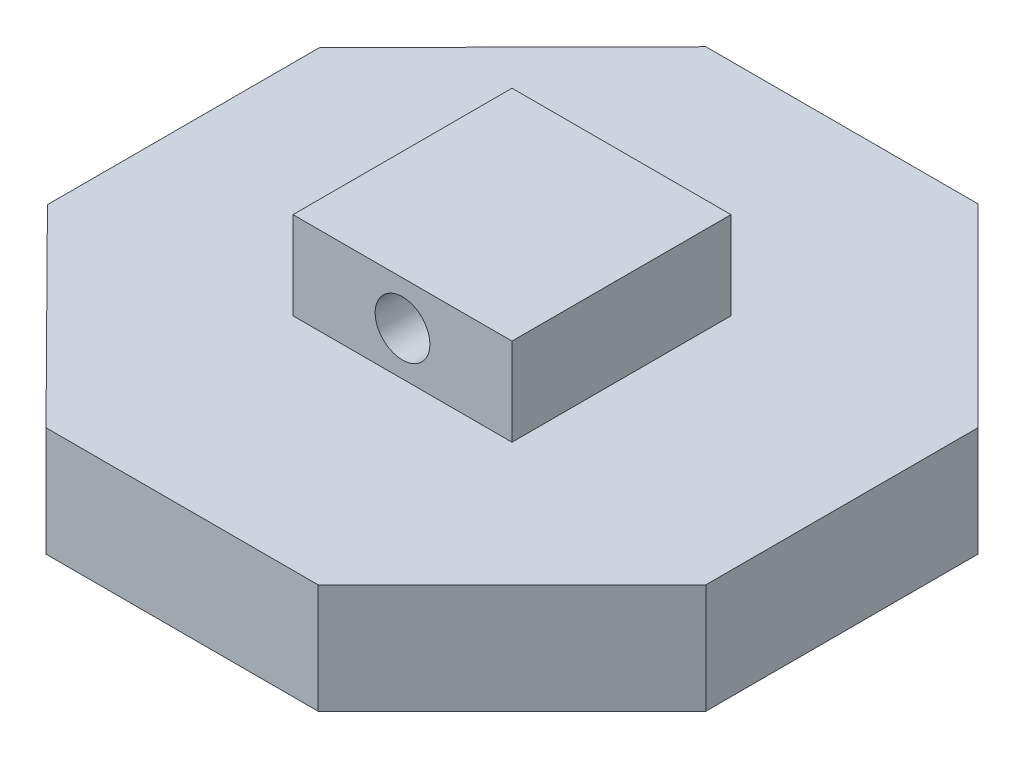
from build123d import *

# Parameters (mm, degrees)
BOSS_EXTRUDE2_DEPTH     = 20
SKETCH3_W               = 40
SKETCH3_H               = 40
BOSS_EXTRUDE3_DEPTH     = 16
CUT_EXTRUDE1_DEPTH      = 107.628201829
CUT_EXTRUDE1_DEPTH_BACK = 107.628201829
SKETCH4_R               = 5


with BuildPart() as part:
    # Sketch2 → Boss-Extrude2 (new body)
    with BuildSketch(Plane(origin=(0, 0, 0), x_dir=(1, 0, 0), z_dir=(0, 1, 0))):
        Polygon((-60, -24.852813742), (-24.852813742, -60.262270904), (24.852813742, -60.262270904), (60.262270904, -24.852813742), (60.262270904, 24.852813742), (24.852813742, 60.262270904), (-24.852813742, 60.262270904), (-60, 24.852813742), align=None)
    extrude(amount=BOSS_EXTRUDE2_DEPTH)

    # Sketch3 → Boss-Extrude3 (add)
    with BuildSketch(Plane(origin=(0, 20, 0), x_dir=(1, 0, 0), z_dir=(0, 1, 0))):
        Rectangle(SKETCH3_W, SKETCH3_H)
    extrude(amount=BOSS_EXTRUDE3_DEPTH)

    # Sketch4 → Cut-Extrude1 (cut, two sides: drawn at the far end of the back side and taken through both)
    with BuildSketch(Plane.XY.offset(20).offset(-CUT_EXTRUDE1_DEPTH_BACK)):
        with Locations((0, 28)):
            Circle(SKETCH4_R)
    extrude(amount=CUT_EXTRUDE1_DEPTH + CUT_EXTRUDE1_DEPTH_BACK, mode=Mode.SUBTRACT)


solid = part.part
